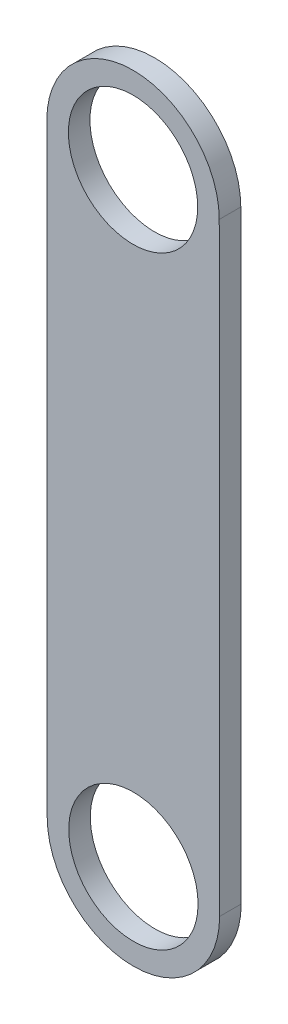
from build123d import *

# Parameters (mm, degrees)
ESQUISSE1_R               = 3
T_LE_DE_BASE_PLI_E1_DEPTH = 1


# Sheet-metal steps are written as plain solids
with BuildPart() as part:
    # Esquisse1 → Tôle de base pliée1 (new body)
    with BuildSketch(Plane.XY):
        with BuildLine():
            Line((-50.484156331, -22.23369645), (-50.467069174, -50.233691237))
            ThreePointArc((-50.467069174, -50.233691237), (-54.464627407, -54.236131514), (-58.467067684, -50.238573281))
            Line((-58.467067684, -50.238573281), (-58.484154841, -22.238578495))
            ThreePointArc((-58.484154841, -22.238578495), (-54.486596608, -18.236138218), (-50.484156331, -22.23369645))
        make_face()
        with Locations((-54.484155586, -22.236137473)):
            Circle(ESQUISSE1_R, mode=Mode.SUBTRACT)
        with Locations((-54.467068429, -50.236132259)):
            Circle(ESQUISSE1_R, mode=Mode.SUBTRACT)
    extrude(amount=-T_LE_DE_BASE_PLI_E1_DEPTH)


solid = part.part
